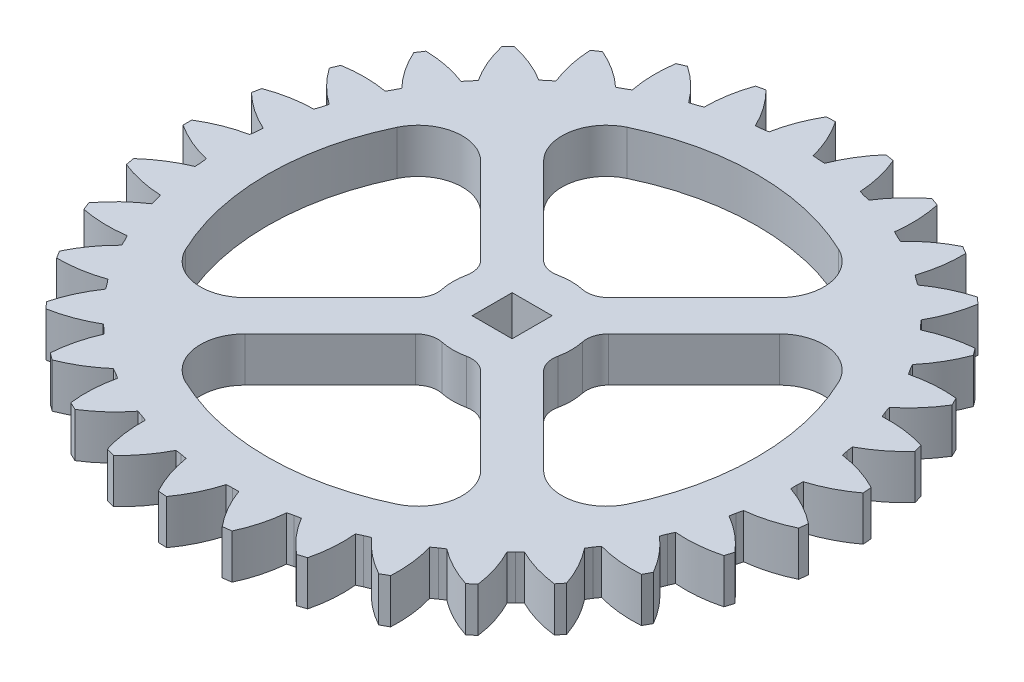
from build123d import *

# Parameters (mm, degrees)
BOSS_EXTRUDE1_DEPTH      = 1.5
CIRPATTERN1_COUNT        = 33
SKETCH4_W                = 2.7
SKETCH4_H                = 2.7
CUT_EXTRUDE1_DEPTH       = 32.641222001
CUT_EXTRUDE2_DEPTH       = 32.641222001
FILLET1_R                = 3
FILLET2_R                = 1.5
CIRPATTERN4_COUNT        = 4
FILLET1_OF_CIRPATTERN4_R = 3
FILLET2_OF_CIRPATTERN4_R = 1.5


with BuildPart() as part:
    # Sketch6 → Boss-Extrude1 (new, symmetric)
    with BuildSketch(Plane(origin=(0, 0, 0), x_dir=(1, 0, 0), z_dir=(0, 1, 0))):
        with BuildLine():
            Line((0, 0), (19.230668789, 3.406942702))
            ThreePointArc((19.230668789, 3.406942702), (19.269891333, 3.202778986), (19.315001591, 2.999834916))
            ThreePointArc((19.315001591, 2.999834916), (20.785797604, 2.661916254), (22.177775211, 2.078968338))
            Line((22.177775211, 2.078968338), (22.201536915, 1.783112977))
            Line((22.201536915, 1.783112977), (22.225298367, 1.487257597))
            ThreePointArc((22.225298367, 1.487257597), (20.944202096, 0.689622169), (19.546191018, 0.121295712))
            ThreePointArc((19.546191018, 0.121295712), (19.534048908, -0.086246573), (19.527913697, -0.294053189))
            Line((19.527913697, -0.294053189), (0, 0))
        make_face()
    boss_extrude1 = extrude(amount=BOSS_EXTRUDE1_DEPTH, both=True)

    # CirPattern1: Boss-Extrude1 ×33 about axis
    cirpattern1_axis = Axis((0, -1.5, 0), (0, 1, 0))
    for i in range(1, CIRPATTERN1_COUNT):
        add(boss_extrude1.rotate(cirpattern1_axis, i * 360 / CIRPATTERN1_COUNT))

    # Sketch4 → Cut-Extrude1 (cut, through all)
    with BuildSketch(Plane(origin=(0, 1.5, 0), x_dir=(1, 0, 0), z_dir=(0, 1, 0))):
        Rectangle(SKETCH4_W, SKETCH4_H)
    extrude(amount=-CUT_EXTRUDE1_DEPTH, mode=Mode.SUBTRACT)

    # Sketch5 → Cut-Extrude2 (cut, through all)
    with BuildSketch(Plane(origin=(0, 1.5, 0), x_dir=(1, 0, 0), z_dir=(0, 1, 0))):
        with BuildLine():
            Line((3.682682292, 1.561361949), (12.705276463, 10.583956119))
            ThreePointArc((12.705276463, 10.583956119), (16.53614759, 0), (12.705276463, -10.583956119))
            Line((12.705276463, -10.583956119), (3.682682292, -1.561361949))
            ThreePointArc((3.682682292, -1.561361949), (4, 0), (3.682682292, 1.561361949))
        make_face()
    cut_extrude2 = extrude(amount=-CUT_EXTRUDE2_DEPTH, mode=Mode.SUBTRACT)

    # Fillet1
    fillet1_edges = [part.edges().sort_by_distance(p)[0] for p in [
        (12.705276463, 0, 10.583956119),
        (12.705276463, 0, -10.583956119),
    ]]
    fillet(fillet1_edges, radius=FILLET1_R)

    # Fillet2
    fillet2_edges = [part.edges().sort_by_distance(p)[0] for p in [
        (3.682682292, 0, 1.561361949),
        (3.682682292, 0, -1.561361949),
    ]]
    fillet(fillet2_edges, radius=FILLET2_R)

    # CirPattern4: Cut-Extrude2 ×4 about axis
    cirpattern4_axis = Axis((0, -1.74625, 0), (0, 1, 0))
    for i in range(1, CIRPATTERN4_COUNT):
        add(cut_extrude2.rotate(cirpattern4_axis, i * 360 / CIRPATTERN4_COUNT), mode=Mode.SUBTRACT)

    # Fillet1 of CirPattern4
    fillet1_of_cirpattern4_edges = [part.edges().sort_by_distance(p)[0] for p in [
        (10.583956119, 0, -12.705276463),
        (-10.583956119, 0, -12.705276463),
        (-12.705276463, 0, -10.583956119),
        (-12.705276463, 0, 10.583956119),
        (-10.583956119, 0, 12.705276463),
        (10.583956119, 0, 12.705276463),
    ]]
    fillet(fillet1_of_cirpattern4_edges, radius=FILLET1_OF_CIRPATTERN4_R)

    # Fillet2 of CirPattern4
    fillet2_of_cirpattern4_edges = [part.edges().sort_by_distance(p)[0] for p in [
        (1.561361949, 0, -3.682682292),
        (-1.561361949, 0, -3.682682292),
        (-3.682682292, 0, -1.561361949),
        (-3.682682292, 0, 1.561361949),
        (-1.561361949, 0, 3.682682292),
        (1.561361949, 0, 3.682682292),
    ]]
    fillet(fillet2_of_cirpattern4_edges, radius=FILLET2_OF_CIRPATTERN4_R)


solid = part.part
